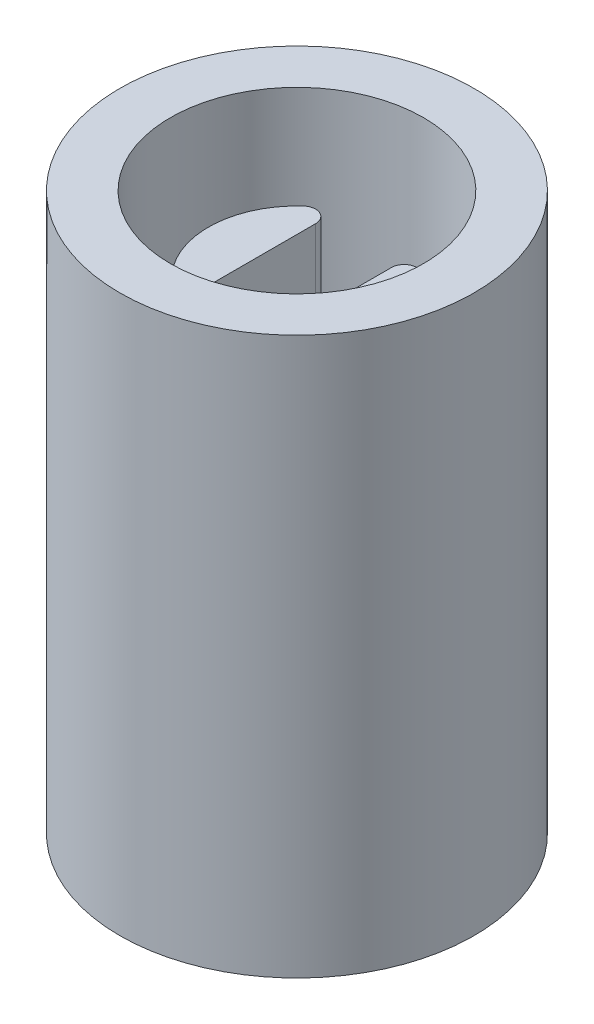
from build123d import *

# Parameters (mm, degrees)
SKETCH1_R           = 7
BOSS_EXTRUDE1_DEPTH = 22
CAVITY1_START       = 2
CAVITY1_OUTLINE_R   = 5
CAVITY1_DEPTH       = 20
CAVITY1_START_2     = 19
CAVITY1_2_DEPTH     = 3
CAVITY1_3_OUTLINE_R = 0.8
CAVITY1_3_DEPTH     = 2
SKETCH2_R           = 0.5
CUT_EXTRUDE1_DEPTH  = 23.315913604


# Read off the part's stored shape, not the designer's step: Cavity1
with BuildPart() as part:
    # Sketch1 → Boss-Extrude1 (new body)
    with BuildSketch(Plane(origin=(0, 0, 0), x_dir=(1, 0, 0), z_dir=(0, 1, 0))):
        with Locations(Location((0, 0, 0), (0, 0, 270))):
            Circle(SKETCH1_R)
    extrude(amount=BOSS_EXTRUDE1_DEPTH)

    # Cavity1 outline → Cavity1 (cut)
    with BuildSketch(Plane(origin=(0, 0, 0), x_dir=(1, 0, 0), z_dir=(0, 1, 0)).offset(CAVITY1_START)):
        Circle(CAVITY1_OUTLINE_R)
        with BuildLine():
            ThreePointArc((-1.5, -2.236067977), (-1.795875854, -2.692503442), (-2.333333333, -2.608745974))
            ThreePointArc((-2.333333333, -2.608745974), (-3.5, 0), (-2.333333333, 2.608745974))
            ThreePointArc((-2.333333333, 2.608745974), (-1.795875854, 2.692503442), (-1.5, 2.236067977))
            Line((-1.5, 2.236067977), (-1.5, -2.236067977))
        make_face(mode=Mode.SUBTRACT)
        with BuildLine():
            Line((1.5, -2.236067977), (1.5, 2.236067977))
            ThreePointArc((1.5, 2.236067977), (1.795875854, 2.692503442), (2.333333333, 2.608745974))
            ThreePointArc((2.333333333, 2.608745974), (3.5, 0), (2.333333333, -2.608745974))
            ThreePointArc((2.333333333, -2.608745974), (1.795875854, -2.692503442), (1.5, -2.236067977))
        make_face(mode=Mode.SUBTRACT)
    extrude(amount=CAVITY1_DEPTH, mode=Mode.SUBTRACT)

    # Cavity1 2 outline → Cavity1 2 (cut)
    with BuildSketch(Plane(origin=(0, 0, 0), x_dir=(1, 0, 0), z_dir=(0, 1, 0)).offset(CAVITY1_START_2)):
        with BuildLine():
            ThreePointArc((2.333333333, 2.608745974), (1.795875854, 2.692503442), (1.5, 2.236067977))
            Line((1.5, 2.236067977), (1.5, -2.236067977))
            ThreePointArc((1.5, -2.236067977), (1.795875854, -2.692503442), (2.333333333, -2.608745974))
            ThreePointArc((2.333333333, -2.608745974), (3.5, 0), (2.333333333, 2.608745974))
        make_face()
        with BuildLine():
            ThreePointArc((-2.333333333, 2.608745974), (-3.5, 0), (-2.333333333, -2.608745974))
            ThreePointArc((-2.333333333, -2.608745974), (-1.795875854, -2.692503442), (-1.5, -2.236067977))
            Line((-1.5, -2.236067977), (-1.5, 2.236067977))
            ThreePointArc((-1.5, 2.236067977), (-1.795875854, 2.692503442), (-2.333333333, 2.608745974))
        make_face()
    extrude(amount=CAVITY1_2_DEPTH, mode=Mode.SUBTRACT)

    # Cavity1 3 outline → Cavity1 3 (cut)
    # profile 1 of 2: a face of its own
    with BuildSketch(Plane(origin=(0, 0, 0), x_dir=(1, 0, 0), z_dir=(0, 1, 0)).offset(CAVITY1_START)):
        with BuildLine():
            ThreePointArc((2.333333333, 2.608745974), (1.795875854, 2.692503442), (1.5, 2.236067977))
            Line((1.5, 2.236067977), (1.5, -2.236067977))
            ThreePointArc((1.5, -2.236067977), (1.795875854, -2.692503442), (2.333333333, -2.608745974))
            ThreePointArc((2.333333333, -2.608745974), (3.5, 0), (2.333333333, 2.608745974))
        make_face()
        with Locations((2.5, 0)):
            Circle(CAVITY1_3_OUTLINE_R, mode=Mode.SUBTRACT)
    # profile 2 of 2: a face of its own
    with BuildSketch(Plane(origin=(0, 0, 0), x_dir=(1, 0, 0), z_dir=(0, 1, 0)).offset(CAVITY1_START)):
        with BuildLine():
            ThreePointArc((-2.333333333, 2.608745974), (-3.5, 0), (-2.333333333, -2.608745974))
            ThreePointArc((-2.333333333, -2.608745974), (-1.795875854, -2.692503442), (-1.5, -2.236067977))
            Line((-1.5, -2.236067977), (-1.5, 2.236067977))
            ThreePointArc((-1.5, 2.236067977), (-1.795875854, 2.692503442), (-2.333333333, 2.608745974))
        make_face()
        with Locations((-2.5, 0)):
            Circle(CAVITY1_3_OUTLINE_R, mode=Mode.SUBTRACT)
    extrude(amount=CAVITY1_3_DEPTH, mode=Mode.SUBTRACT)

    # Sketch2 → Cut-Extrude1 (cut, through all)
    with BuildSketch(Plane(origin=(0, 2, 0), x_dir=(1, 0, 0), z_dir=(0, 1, 0))):
        with Locations(Location((0, 0, 0), (0, 0, 270))):
            Circle(SKETCH2_R)
    extrude(amount=-CUT_EXTRUDE1_DEPTH, mode=Mode.SUBTRACT)


solid = part.part
